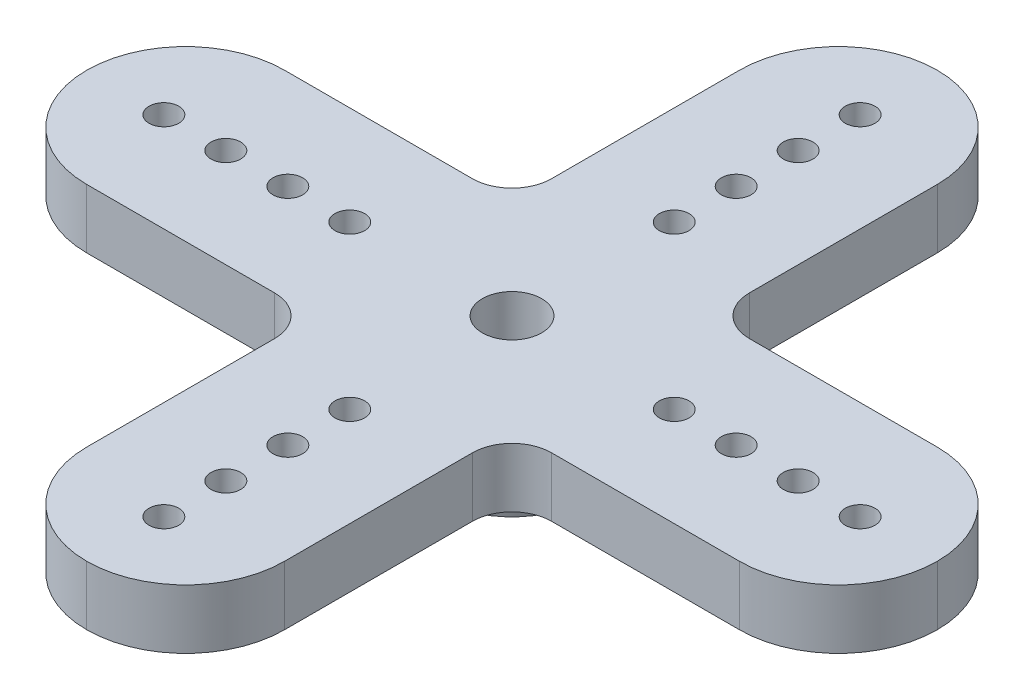
from build123d import *

# Parameters (mm, degrees)
BOSS_EXTRUDE1_DEPTH = 3
FILLET1_R           = 2
FILLET2_R           = 5
SKETCH2_R           = 4.5
BOSS_EXTRUDE2_DEPTH = 3
DRAFT1_ANGLE        = 10
SKETCH3_R           = 3
CUT_EXTRUDE1_DEPTH  = 3
SKETCH4_R           = 1.5
CUT_EXTRUDE2_DEPTH  = 31.553232235
SKETCH5_R           = 0.75
CUT_EXTRUDE3_DEPTH  = 31.991934435
CIRPATTERN1_COUNT   = 4


with BuildPart() as part:
    # Sketch1 → Boss-Extrude1 (new body)
    with BuildSketch(Plane(origin=(0, 0, 0), x_dir=(1, 0, 0), z_dir=(0, 1, 0))):
        Polygon((-5, 5), (-5, 21.5), (5, 21.5), (5, 5), (21.5, 5), (21.5, -5), (5, -5), (5, -21.5), (-5, -21.5), (-5, -5), (-21.5, -5), (-21.5, 5), align=None)
    extrude(amount=BOSS_EXTRUDE1_DEPTH)

    # Fillet1
    fillet1_edges = [part.edges().sort_by_distance(p)[0] for p in [
        (-5, 1.5, -5),
        (5, 1.5, -5),
        (5, 1.5, 5),
        (-5, 1.5, 5),
    ]]
    fillet(fillet1_edges, radius=FILLET1_R)

    # Fillet2
    fillet2_edges = [part.edges().sort_by_distance(p)[0] for p in [
        (-21.5, 1.5, -5),
        (-5, 1.5, -21.5),
        (-21.5, 1.5, 5),
        (5, 1.5, -21.5),
        (21.5, 1.5, -5),
        (21.5, 1.5, 5),
        (5, 1.5, 21.5),
        (-5, 1.5, 21.5),
    ]]
    fillet(fillet2_edges, radius=FILLET2_R - 0.0001)  # a hair under: the kernel refuses the full size

    # Sketch2 → Boss-Extrude2 (add)
    with BuildSketch(Plane.XZ):
        with Locations(Location((0, 0, 0), (0, 0, 90))):
            Circle(SKETCH2_R)
    extrude(amount=BOSS_EXTRUDE2_DEPTH)

    # Draft1
    draft1_faces = [part.faces().sort_by_distance(p)[0] for p in [
        (0, -1.5, -4.5),
    ]]
    draft(draft1_faces, Plane(origin=(0, 0, 0), x_dir=(0, 0, -1), z_dir=(0, -1, 0)), DRAFT1_ANGLE)

    # Sketch3 → Cut-Extrude1 (cut)
    with BuildSketch(Plane.XZ.offset(3)):
        with Locations(Location((0, 0, 0), (0, 0, 270))):
            Circle(SKETCH3_R)
    extrude(amount=-CUT_EXTRUDE1_DEPTH, mode=Mode.SUBTRACT)

    # Sketch4 → Cut-Extrude2 (cut, through all)
    with BuildSketch(Plane.XZ):
        with Locations(Location((0, 0, 0), (0, 0, 270))):
            Circle(SKETCH4_R)
    extrude(amount=-CUT_EXTRUDE2_DEPTH, mode=Mode.SUBTRACT)

    # Sketch5 → Cut-Extrude3 (cut, through all)
    with BuildSketch(Plane(origin=(0, 3, 0), x_dir=(1, 0, 0), z_dir=(0, 1, 0))):
        with Locations(Location((0, 17.6, 0), (0, 0, 270))):
            Circle(SKETCH5_R)
        with Locations(Location((0, 14.466666667, 0), (0, 0, 270))):
            Circle(SKETCH5_R)
        with Locations(Location((0, 11.333333333, 0), (0, 0, 270))):
            Circle(SKETCH5_R)
        with Locations(Location((0, 8.2, 0), (0, 0, 270))):
            Circle(SKETCH5_R)
    cut_extrude3 = extrude(amount=-CUT_EXTRUDE3_DEPTH, mode=Mode.SUBTRACT)

    # CirPattern1: Cut-Extrude3 ×4 about axis
    cirpattern1_axis = Axis((0, 0, 0), (0, 1, 0))
    for i in range(1, CIRPATTERN1_COUNT):
        add(cut_extrude3.rotate(cirpattern1_axis, i * 360 / CIRPATTERN1_COUNT), mode=Mode.SUBTRACT)


solid = part.part
